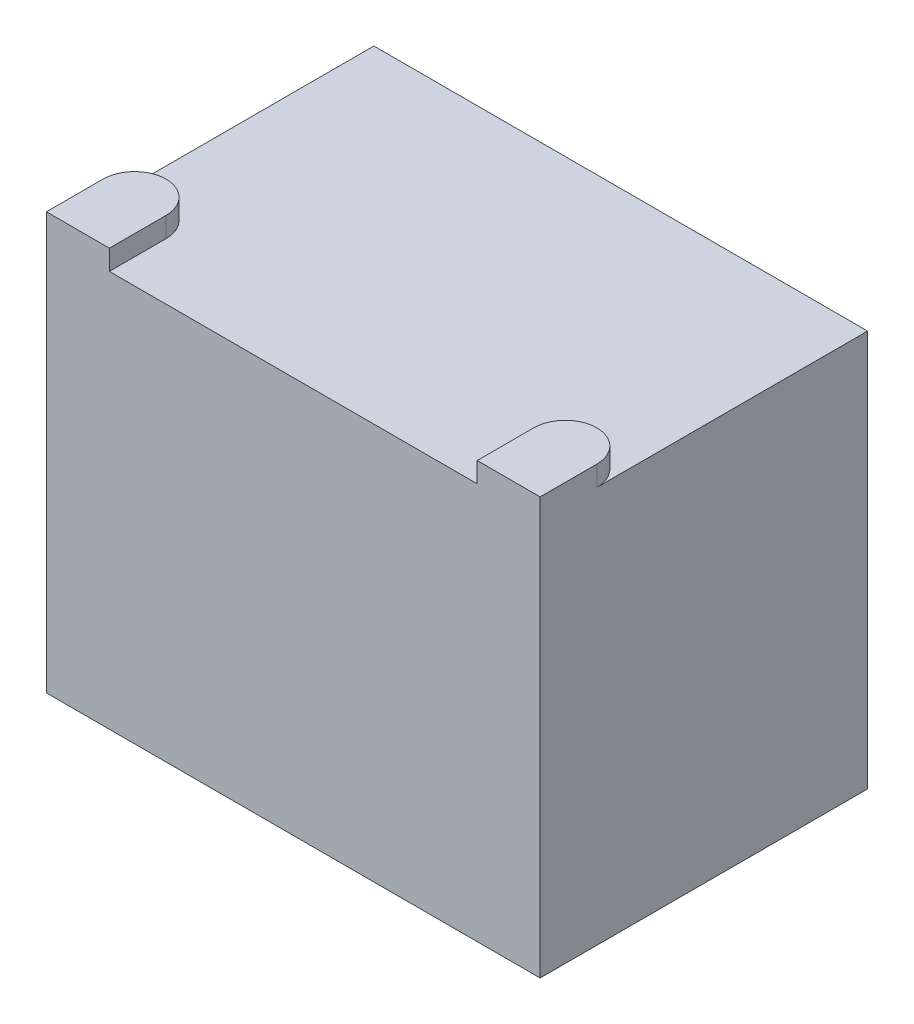
from build123d import *

# Parameters (mm, degrees)
SKETCH_1_W      = 196.088
SKETCH_1_H      = 130.048
EXTRUDE_1_DEPTH = 157.48
SKETCH_3_W      = 25
SKETCH_3_H      = 35
EXTRUDE_2_DEPTH = 8
FILLET_2_R      = 12.5


with BuildPart() as part:
    # 草图1 → 凸台-拉伸1 (new body)
    with BuildSketch(Plane(origin=(0, 0, 0), x_dir=(1, 0, 0), z_dir=(0, 1, 0))):
        Rectangle(SKETCH_1_W, SKETCH_1_H)
    extrude(amount=EXTRUDE_1_DEPTH)

    # 草图3 → 凸台-拉伸2 (add)
    with BuildSketch(Plane(origin=(0, 157.48, 0), x_dir=(1, 0, 0), z_dir=(0, 1, 0))):
        with Locations((-85.544, -47.524)):
            Rectangle(SKETCH_3_W, SKETCH_3_H)
        with Locations((85.544, -47.524)):
            Rectangle(SKETCH_3_W, SKETCH_3_H)
    extrude(amount=EXTRUDE_2_DEPTH)

    # 圆角2
    fillet_2_edges = [part.edges().sort_by_distance(p)[0] for p in [
        (73.044, 161.48, 30.024),
        (98.044, 161.48, 30.024),
        (-98.044, 161.48, 30.024),
        (-73.044, 161.48, 30.024),
    ]]
    fillet(fillet_2_edges, radius=FILLET_2_R - 0.0001)  # a hair under: the kernel refuses the full size


solid = part.part
